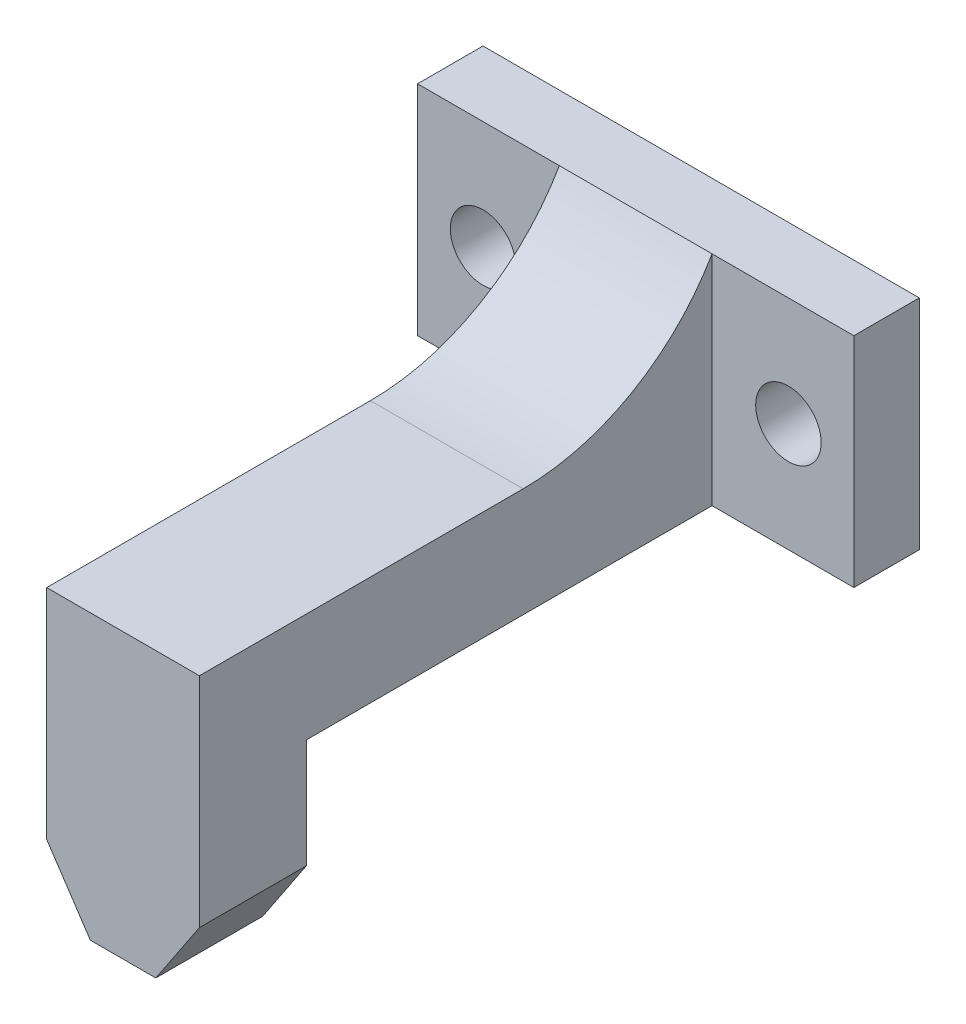
from build123d import *

# Parameters (mm, degrees)
SKETCH_1_W          = 7
SKETCH_1_H          = 5
EXTRUDE_1_DEPTH     = 13
SKETCH_2_W          = 7
SKETCH_2_H          = 5
EXTRUDE_2_DEPTH     = 18.5
SKETCH_4_W          = 20
SKETCH_4_H          = 10
EXTRUDE_3_DEPTH     = 3
SKETCH_5_R          = 1.5
CUT_EXTRUDE_1_DEPTH = 34.559648389
FILLET_1_R          = 10
SKETCH_6_W          = 7
SKETCH_6_H          = 8
CUT_EXTRUDE_2_DEPTH = 0.1
CHAMFER_3_SIZE      = 2
CHAMFER_3_SIZE2     = 3


with BuildPart() as part:
    # 草图1 → 凸台-拉伸1 (new body)
    with BuildSketch(Plane(origin=(0, 0, 0), x_dir=(1, 0, 0), z_dir=(0, 1, 0))):
        Rectangle(SKETCH_1_W, SKETCH_1_H)
    extrude(amount=EXTRUDE_1_DEPTH)

    # 草图2 → 凸台-拉伸2 (add)
    with BuildSketch(Plane(origin=(0, 0, -2.5), x_dir=(-1, 0, 0), z_dir=(0, 0, -1))):
        with Locations((0, 10.5)):
            Rectangle(SKETCH_2_W, SKETCH_2_H)
    extrude(amount=EXTRUDE_2_DEPTH)

    # 草图4 → 凸台-拉伸3 (add)
    with BuildSketch(Plane(origin=(0, 0, -21), x_dir=(-1, 0, 0), z_dir=(0, 0, -1))):
        with Locations((0, 13)):
            Rectangle(SKETCH_4_W, SKETCH_4_H)
    extrude(amount=EXTRUDE_3_DEPTH)

    # 草图5 → 切除-拉伸1 (cut, through all)
    with BuildSketch(Plane(origin=(0, 0, -24), x_dir=(-1, 0, 0), z_dir=(0, 0, -1))):
        with Locations((-7, 13)):
            Circle(SKETCH_5_R)
        with Locations((7, 13)):
            Circle(SKETCH_5_R)
    extrude(amount=-CUT_EXTRUDE_1_DEPTH, mode=Mode.SUBTRACT)

    # 圆角1
    # the kernel refuses this fillet: 10 mm, written as the material it adds along each edge
    with BuildSketch(Plane(origin=(3.5, 13, -21), x_dir=(0, 1, 0), z_dir=(-1, 0, 0))) as fillet_1_piece_1:
        with BuildLine():
            CenterArc((10, -8.660254038), FILLET_1_R, 120, 60)
            Line((0, -8.660254038), (-0.2, -8.660254038))
            Line((-0.2, -8.660254038), (-0.2, 0))
            Line((-0.2, 0), (0, 0.2))
            ThreePointArc((0, 0.2), (2.5, 0.2), (4.9, 0.173205081))
            Line((4.9, 0.173205081), (5, 0))
        make_face()
    extrude(amount=7)

    # 草图6 → 切除-拉伸2 (cut)
    with BuildSketch(Plane(origin=(0, 0, -2.5), x_dir=(-1, 0, 0), z_dir=(0, 0, -1))):
        with Locations((0, 4)):
            Rectangle(SKETCH_6_W, SKETCH_6_H)
    extrude(amount=-CUT_EXTRUDE_2_DEPTH, mode=Mode.SUBTRACT)

    # 倒角3
    chamfer_3_edges = [part.edges().sort_by_distance(p)[0] for p in [
        (3.5, 0, 0.05),
        (-3.5, 0, 0.05),
    ]]
    chamfer_3_side = [part.faces().sort_by_distance(p)[0] for p in [
        (0, 0, 0.05),
    ]]
    chamfer(chamfer_3_edges, length=CHAMFER_3_SIZE, length2=CHAMFER_3_SIZE2, reference=chamfer_3_side[0])


solid = part.part
